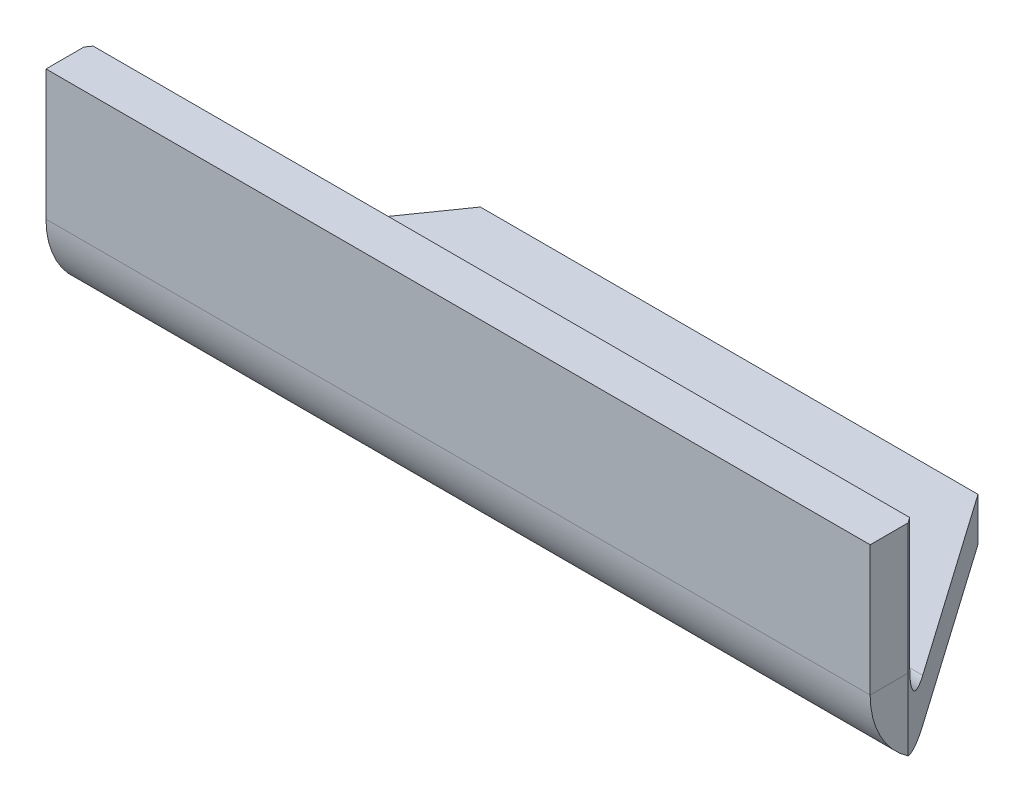
from build123d import *

# Parameters (mm, degrees)
SKETCH1_W                    = 152
SKETCH1_H                    = 50
BASE_FLANGE1_DEPTH           = 8
EDGE_FLANGE1_STRIP_W         = 48
EDGE_FLANGE1_STRIP_H         = 8
EDGE_FLANGE1_STRIP_CUT_DEPTH = 152
EDGE_FLANGE1_DEPTH           = 152
CHAMFER1_SIZE                = 43
CHAMFER1_SIZE2               = 30.108924143
MIRROR3_START                = 51.931179512
MIRROR3_OUTLINE_W            = 56
MIRROR3_OUTLINE_H            = 41
MIRROR3_DEPTH                = 24.663786763


# Read off the part's stored shape, not the designer's step: Mirror3
# Sheet-metal steps are written as plain solids
with BuildPart() as part:
    # Sketch1 → Base-Flange1 (new body)
    with BuildSketch(Plane(origin=(0, 0, 0), x_dir=(1, 0, 0), z_dir=(0, 1, 0))):
        Rectangle(SKETCH1_W, SKETCH1_H)
    extrude(amount=-BASE_FLANGE1_DEPTH)

    # Edge-Flange1 strip (across the edge) → Edge-Flange1 strip cut (cut)
    with BuildSketch(Plane(origin=(-76, 0, 25), x_dir=(0, 0, -1), z_dir=(1, 0, 0))):
        with Locations((-8, -4)):
            Rectangle(EDGE_FLANGE1_STRIP_W, EDGE_FLANGE1_STRIP_H)
    extrude(amount=EDGE_FLANGE1_STRIP_CUT_DEPTH, mode=Mode.SUBTRACT)

    # Edge-Flange1 section (across the edge) → Edge-Flange1 (add)
    with BuildSketch(Plane(origin=(-76, 0, 25), x_dir=(0, 0, -1), z_dir=(1, 0, 0))):
        with BuildLine():
            Line((0, 8), (0, 32))
            Line((0, 32), (8, 32))
            Line((8, 32), (8, 8))
            ThreePointArc((8, 8), (10.343145751, 2.343145751), (16, 0))
            Line((16, 0), (16, -8))
            ThreePointArc((16, -8), (4.686291501, -3.313708499), (0, 8))
        make_face()
    extrude(amount=EDGE_FLANGE1_DEPTH)

    # Chamfer1
    chamfer1_edges = [part.edges().sort_by_distance(p)[0] for p in [
        (-76, -4, -25),
    ]]
    chamfer1_side = [part.faces().sort_by_distance(p)[0] for p in [
        (-76, -0.640312424, -8),
    ]]
    chamfer(chamfer1_edges, length=CHAMFER1_SIZE, length2=CHAMFER1_SIZE2, reference=chamfer1_side[0])

    # Mirror3 outline → Mirror3 (cut)
    with BuildSketch(Plane(origin=(0, 0, 0), x_dir=(0.5735764363510512, 0, 0.8191520442889882), z_dir=(0.8191520442889882, 0, -0.5735764363510512)).offset(MIRROR3_START)):
        with Locations((32, -12.5)):
            Rectangle(MIRROR3_OUTLINE_W, MIRROR3_OUTLINE_H)
    extrude(amount=MIRROR3_DEPTH, mode=Mode.SUBTRACT)


solid = part.part
